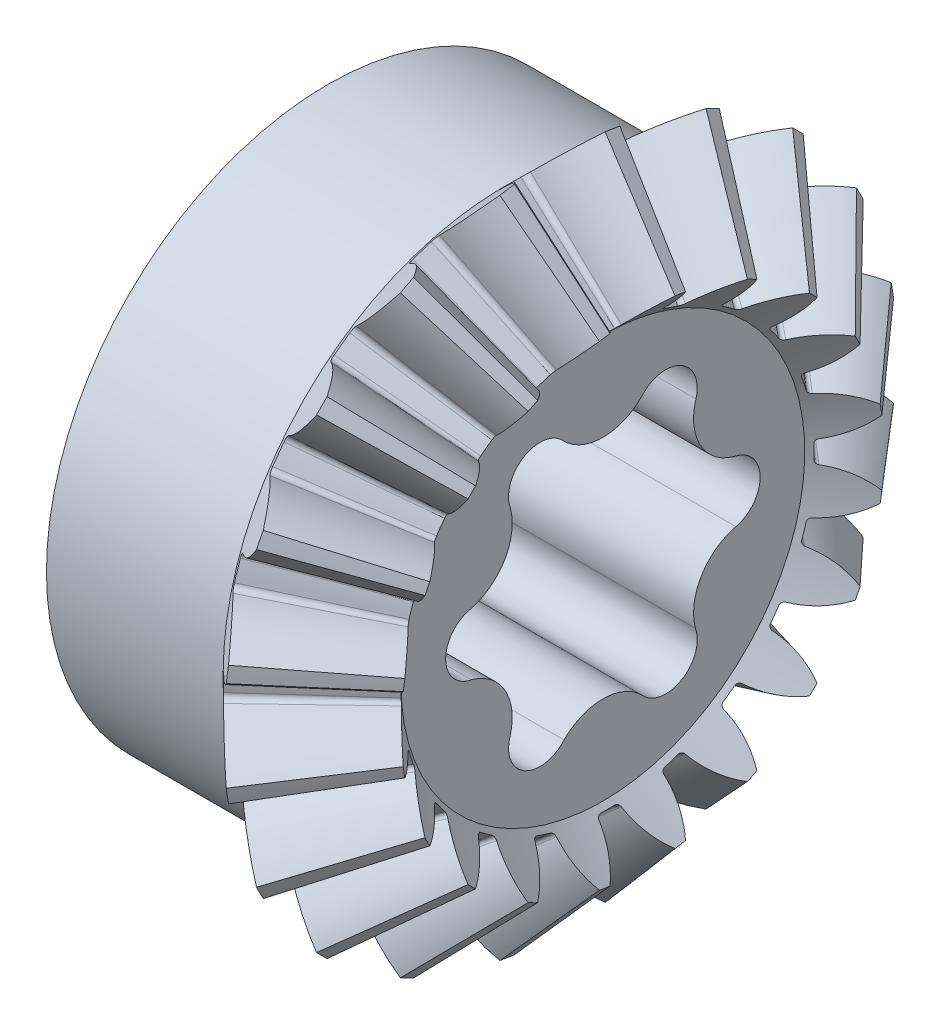
from build123d import *

# Parameters (mm, degrees)
TEETHCUTS_COUNT    = 20
TEETHCUTS_ANGLE    = 342
HUBSKE_R           = 26.848955406
HUB_DEPTH          = 16.852511406
BORSKE_R           = 10
BORE_DEPTH         = 50.0035052
SKETCH1_R          = 7.5
CUT_EXTRUDE1_DEPTH = 55.099745833


with BuildPart() as part:
    # BasProSke → Base-Revolve (revolve)
    with BuildSketch(Plane(origin=(0, 0, 0), x_dir=(1, 0, 0), z_dir=(0, 1, 0)), mode=Mode.PRIVATE) as base_revolve_sk:
        Polygon((0, 0), (0, 26.848955409), (5.272364942, 32.121320342), (13.157646308, 23.03603896), (9.376531368, 19.254924027), (9.376531368, 0), align=None)
    revolve(base_revolve_sk.sketch.rotate(Axis((-10, 0, 0), (1, 0, 0)), 180), axis=Axis((-10, 0, 0), (1, 0, 0)))

    # ToothCut: read off the stored shape, not the designer's step
    # ToothCut: loft between two sections, ruled curve by curve
    toothcut_from = [
        Edge.make_bspline([(33.157087436, 0.006042839, -0.009394548), (33.152863673, 0.001819076, -0.014828261), (33.14718221, -0.003862386, -0.01402355), (33.143804317, -0.00724028, -0.007513154)], [0, 0, 0, 0, 1, 1, 1, 1], 3, [1, 0.779325147, 0.779325147, 1]),
        Edge.make_bspline([(33.143804317, -0.00724028, 0.007513154), (33.14718221, -0.003862386, 0.01402355), (33.152863673, 0.001819076, 0.014828261), (33.157087436, 0.006042839, 0.009394548)], [0, 0, 0, 0, 1, 1, 1, 1], 3, [1, 0.779325147, 0.779325147, 1]),
        Edge.make_bspline([(33.143804317, -0.00724028, -0.007513154), (33.143304599, -0.007739998, -0.00655002), (33.142905272, -0.008139324, -0.005497339), (33.142614221, -0.008430376, -0.004375893)], [0, 0, 0, 0, 1, 1, 1, 1], 3, [1, 0.993418719, 0.993418719, 1]),
        Edge.make_bspline([(33.142614221, -0.008430376, 0.004375893), (33.142905272, -0.008139324, 0.005497339), (33.143304599, -0.007739998, 0.00655002), (33.143804317, -0.00724028, 0.007513154)], [0, 0, 0, 0, 1, 1, 1, 1], 3, [1, 0.993418719, 0.993418719, 1]),
        Edge.make_bspline([(33.142614221, -0.008430376, -0.004375893), (33.141873209, -0.009171387, -0.001520712), (33.141873209, -0.009171387, 0.001520712), (33.142614221, -0.008430376, 0.004375893)], [0, 0, 0, 0, 1, 1, 1, 1], 3, [1, 0.959176567, 0.959176567, 1]),
        Edge.make_line((33.157087436, 0.006042839, 0.009394548), (33.157087436, 0.006042839, -0.009394548)),
    ]
    toothcut_to = [
        Edge.make_bspline([(5.493726667, 32.342682067, -4.820385483), (4.247056242, 31.096011643, -3.064179758), (2.684057483, 29.533012888, -1.921068819), (0.950113908, 27.799069316, -1.49738)], [0, 0, 0, 0, 1, 1, 1, 1], 3, [1, 0.968994747, 0.968994747, 1]),
        Edge.make_bspline([(0.950113908, 27.799069316, 1.49738), (2.684057483, 29.533012888, 1.921068819), (4.247056242, 31.096011643, 3.064179758), (5.493726667, 32.342682067, 4.820385483)], [0, 0, 0, 0, 1, 1, 1, 1], 3, [1, 0.968994747, 0.968994747, 1]),
        Edge.make_bspline([(0.950113908, 27.799069316, -1.49738), (0.743684109, 27.592639517, -1.446938914), (0.611563875, 27.460519283, -1.217027377), (0.61886206, 27.467817468, -0.920945801)], [0, 0, 0, 0, 1, 1, 1, 1], 3, [1, 0.835733327, 0.835733327, 1]),
        Edge.make_bspline([(0.61886206, 27.467817468, 0.920945801), (0.611563875, 27.460519283, 1.217027377), (0.743684109, 27.592639517, 1.446938914), (0.950113908, 27.799069316, 1.49738)], [0, 0, 0, 0, 1, 1, 1, 1], 3, [1, 0.835733327, 0.835733327, 1]),
        Edge.make_bspline([(0.61886206, 27.467817468, -0.920945801), (0.633992737, 27.482948145, -0.307106216), (0.633992737, 27.482948145, 0.307106216), (0.61886206, 27.467817468, 0.920945801)], [0, 0, 0, 0, 1, 1, 1, 1], 3, [1, 0.999595312, 0.999595312, 1]),
        Edge.make_line((5.493726667, 32.342682067, 4.820385483), (5.493726667, 32.342682067, -4.820385483)),
    ]
    toothcut = Solid(Shell([*[Face.make_surface_from_curves(toothcut_from[k], toothcut_to[k]) for k in range(6)], Face(Wire(toothcut_from)), Face(Wire(toothcut_to))]))
    add(toothcut, mode=Mode.SUBTRACT)

    # TeethCuts: ToothCut ×20 about axis
    teethcuts_axis = Axis((-10, 0, 0), (1, 0, 0))
    for i in range(1, TEETHCUTS_COUNT):
        add(toothcut.rotate(teethcuts_axis, i * TEETHCUTS_ANGLE / (TEETHCUTS_COUNT - 1)), mode=Mode.SUBTRACT)

    # HubSke → Hub (add)
    with BuildSketch(Plane.ZY):
        Circle(HUBSKE_R)
    extrude(amount=HUB_DEPTH)

    # BorSke → Bore (cut, symmetric)
    with BuildSketch(Plane(origin=(0, 0, 0), x_dir=(0, 0, -1), z_dir=(1, 0, 0))):
        with Locations(Location((0, 0, 0), (0, 0, 180))):
            Circle(BORSKE_R)
    extrude(amount=BORE_DEPTH, both=True, mode=Mode.SUBTRACT)

    # Sketch1 → Cut-Extrude1 (cut, through all)
    with BuildSketch(Plane.ZY.offset(16.852511406)):
        with BuildLine():
            ThreePointArc((3.820000599, 12.448598131), (0.078776316, 10.800591053), (-3.710214456, 12.335594436))
            ThreePointArc((-3.710214456, 12.335594436), (-7.429054636, 13.030168776), (-8.870801923, 9.532516627))
            ThreePointArc((-8.870801923, 9.532516627), (-9.31419807, 5.468517818), (-12.538045381, 2.954657246))
            ThreePointArc((-12.538045381, 2.954657246), (-14.998984494, 0.081334347), (-12.690802522, -2.916081504))
            ThreePointArc((-12.690802522, -2.916081504), (-9.392974386, -5.332073235), (-8.827830925, -9.380937191))
            ThreePointArc((-8.827830925, -9.380937191), (-7.569929858, -12.948834429), (-3.820000599, -12.448598131))
            ThreePointArc((-3.820000599, -12.448598131), (-0.078776316, -10.800591053), (3.710214456, -12.335594436))
            ThreePointArc((3.710214456, -12.335594436), (7.429054636, -13.030168776), (8.870801923, -9.532516627))
            ThreePointArc((8.870801923, -9.532516627), (9.31419807, -5.468517818), (12.538045381, -2.954657246))
            ThreePointArc((12.538045381, -2.954657246), (14.998984494, -0.081334347), (12.690802522, 2.916081504))
            ThreePointArc((12.690802522, 2.916081504), (9.392974386, 5.332073235), (8.827830925, 9.380937191))
            ThreePointArc((8.827830925, 9.380937191), (7.569929858, 12.948834429), (3.820000599, 12.448598131))
        make_face()
        Circle(SKETCH1_R, mode=Mode.SUBTRACT)
    extrude(amount=-CUT_EXTRUDE1_DEPTH, mode=Mode.SUBTRACT)


solid = part.part
